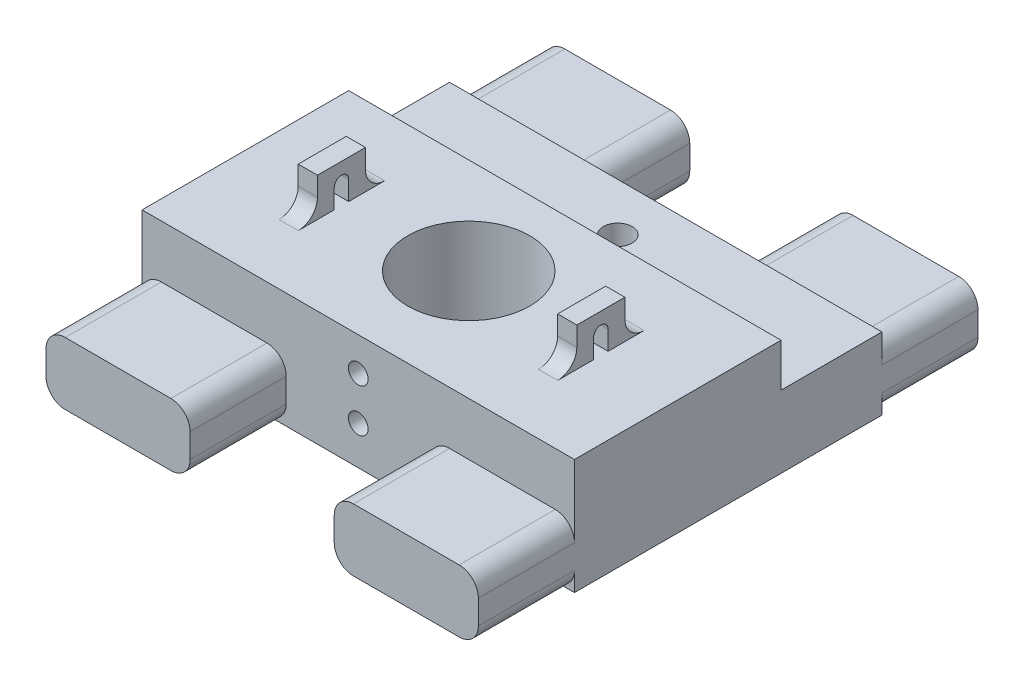
from build123d import *

# Parameters (mm, degrees)
SKETCH1_W                    = 45
SKETCH1_H                    = 32
BOSS_EXTRUDE1_DEPTH          = 12
SKETCH2_W                    = 45
SKETCH2_H                    = 10.5
CUT_EXTRUDE1_DEPTH           = 4.5
SKETCH3_R                    = 1.5
CUT_EXTRUDE2_DEPTH           = 7.5
SKETCH4_R                    = 6.35
CUT_EXTRUDE3_DEPTH           = 12
SKETCH5_W                    = 15
SKETCH5_H                    = 6.5
BOSS_EXTRUDE3_DEPTH          = 10
SKETCH6_W                    = 15
SKETCH6_H                    = 6.5
BOSS_EXTRUDE4_DEPTH          = 10
SKETCH7_W                    = 2
SKETCH7_H                    = 5
BOSS_EXTRUDE5_DEPTH          = 4
M2_5X0_45_TAPPED_HOLE1_D     = 2.05
M2_5X0_45_TAPPED_HOLE1_DEPTH = 11.499
M2_5X0_45_TAPPED_HOLE1_TIP   = 0.615882135
CUT_EXTRUDE4_REACH           = 65.6
CUT_EXTRUDE4_END_RADIUS      = 6.35
SKETCH10_R                   = 1.025
FILLET1_DEPTH                = 11
FILLET2_R                    = 2
FILLET3_DEPTH                = 11
FILLET4_R                    = 2
FILLET5_START                = -43
FILLET5_DEPTH                = 11
FILLET6_START                = -43
FILLET6_DEPTH                = 11
FILLET7_R                    = 2
CUT_EXTRUDE5_REACH           = 60.215
FILLET8_R                    = 2


with BuildPart() as part:
    # Sketch1 → Boss-Extrude1 (new body)
    with BuildSketch(Plane(origin=(0, 0, 0), x_dir=(1, 0, 0), z_dir=(0, 1, 0))):
        with Locations((22.5, 16)):
            Rectangle(SKETCH1_W, SKETCH1_H)
    extrude(amount=BOSS_EXTRUDE1_DEPTH)

    # Sketch2 → Cut-Extrude1 (cut)
    with BuildSketch(Plane(origin=(0, 12, 0), x_dir=(1, 0, 0), z_dir=(0, 1, 0))):
        with Locations((22.5, 26.75)):
            Rectangle(SKETCH2_W, SKETCH2_H)
    extrude(amount=-CUT_EXTRUDE1_DEPTH, mode=Mode.SUBTRACT)

    # Sketch3 → Cut-Extrude2 (cut)
    with BuildSketch(Plane(origin=(0, 7.5, 0), x_dir=(1, 0, 0), z_dir=(0, 1, 0))):
        with Locations(Location((22.5, 27, 0), (0, 0, 270))):
            Circle(SKETCH3_R)
    extrude(amount=-CUT_EXTRUDE2_DEPTH, mode=Mode.SUBTRACT)

    # Sketch4 → Cut-Extrude3 (cut)
    with BuildSketch(Plane(origin=(0, 12, 0), x_dir=(1, 0, 0), z_dir=(0, 1, 0))):
        with Locations(Location((22.5, 11.5, 0), (0, 0, 270))):
            Circle(SKETCH4_R)
    extrude(amount=-CUT_EXTRUDE3_DEPTH, mode=Mode.SUBTRACT)

    # Sketch5 → Boss-Extrude3 (add)
    with BuildSketch(Plane(origin=(0, 0, -32), x_dir=(-1, 0, 0), z_dir=(0, 0, -1))):
        with Locations((-37.5, 3.25)):
            Rectangle(SKETCH5_W, SKETCH5_H)
        with Locations((-7.5, 3.25)):
            Rectangle(SKETCH5_W, SKETCH5_H)
    extrude(amount=BOSS_EXTRUDE3_DEPTH)

    # Sketch6 → Boss-Extrude4 (add)
    with BuildSketch(Plane.XY):
        with Locations((7.5, 3.25)):
            Rectangle(SKETCH6_W, SKETCH6_H)
        with Locations((37.5, 3.25)):
            Rectangle(SKETCH6_W, SKETCH6_H)
    extrude(amount=BOSS_EXTRUDE4_DEPTH)

    # Sketch7 → Boss-Extrude5 (add)
    with BuildSketch(Plane(origin=(0, 12, 0), x_dir=(1, 0, 0), z_dir=(0, 1, 0))):
        with Locations((9, 10.75)):
            Rectangle(SKETCH7_W, SKETCH7_H)
        with Locations((36, 10.75)):
            Rectangle(SKETCH7_W, SKETCH7_H)
    extrude(amount=BOSS_EXTRUDE5_DEPTH)

    # M2.5x0.45 Tapped Hole1
    with Locations(Plane.XY):
        with Locations((22.5, 8.5)):
            Hole(M2_5X0_45_TAPPED_HOLE1_D / 2, depth=M2_5X0_45_TAPPED_HOLE1_DEPTH)
            with Locations((0, 0, -(M2_5X0_45_TAPPED_HOLE1_DEPTH + M2_5X0_45_TAPPED_HOLE1_TIP / 2))):  # 118° drill point
                Cone(0, M2_5X0_45_TAPPED_HOLE1_D / 2, M2_5X0_45_TAPPED_HOLE1_TIP, mode=Mode.SUBTRACT)

    # Cut-Extrude4: up to this cylinder (the profile starts outside it)
    cut_extrude4_end = Plane(origin=(22.5, 4, -11.5), z_dir=(0, 1, 0)) * Cylinder(CUT_EXTRUDE4_END_RADIUS, 144.9, mode=Mode.PRIVATE)
    # Sketch10 → Cut-Extrude4 (cut, up to the surface)
    with BuildSketch(Plane.XY, mode=Mode.PRIVATE) as cut_extrude4_sk1:
        with Locations((22.5, 4)):
            Circle(SKETCH10_R)
    cut_extrude4_tool1 = extrude(cut_extrude4_sk1.sketch, amount=-CUT_EXTRUDE4_REACH, mode=Mode.PRIVATE) - cut_extrude4_end
    add(cut_extrude4_tool1.solids().sort_by_distance((22.5, 4, 0))[0], mode=Mode.SUBTRACT)

    # Fillet1: read off the stored shape, not the designer's step
    # Fillet1 outline → Fillet1 (cut)
    with BuildSketch(Plane.XY):
        with BuildLine():
            Line((0, 0), (2, 0))
            ThreePointArc((2, 0), (0.585786438, 0.585786438), (0, 2))
            Line((0, 2), (0, 0))
        make_face()
    extrude(amount=FILLET1_DEPTH, mode=Mode.SUBTRACT)

    # Fillet2
    fillet2_edges = [part.edges().sort_by_distance(p)[0] for p in [
        (15, 0, 5),
        (30, 0, 5),
    ]]
    fillet(fillet2_edges, radius=FILLET2_R)

    # Fillet3: read off the stored shape, not the designer's step
    # Fillet3 outline → Fillet3 (cut)
    with BuildSketch(Plane.XY):
        with BuildLine():
            ThreePointArc((45, 2), (44.414213562, 0.585786438), (43, 0))
            Line((43, 0), (45, 0))
            Line((45, 0), (45, 2))
        make_face()
    extrude(amount=FILLET3_DEPTH, mode=Mode.SUBTRACT)

    # Fillet4
    fillet4_edges = [part.edges().sort_by_distance(p)[0] for p in [
        (30, 0, -37),
        (15, 0, -37),
    ]]
    fillet(fillet4_edges, radius=FILLET4_R)

    # Fillet5: read off the stored shape, not the designer's step
    # Fillet5 outline → Fillet5 (cut)
    with BuildSketch(Plane.XY.offset(FILLET5_START)):
        with BuildLine():
            ThreePointArc((45, 2), (44.414213562, 0.585786438), (43, 0))
            Line((43, 0), (45, 0))
            Line((45, 0), (45, 2))
        make_face()
    extrude(amount=FILLET5_DEPTH, mode=Mode.SUBTRACT)

    # Fillet6: read off the stored shape, not the designer's step
    # Fillet6 outline → Fillet6 (cut)
    with BuildSketch(Plane.XY.offset(FILLET6_START)):
        with BuildLine():
            Line((0, 0), (2, 0))
            ThreePointArc((2, 0), (0.585786438, 0.585786438), (0, 2))
            Line((0, 2), (0, 0))
        make_face()
    extrude(amount=FILLET6_DEPTH, mode=Mode.SUBTRACT)

    # Fillet7
    fillet7_edges = [part.edges().sort_by_distance(p)[0] for p in [
        (45, 6.5, -37),
        (30, 6.5, -37),
        (15, 6.5, -37),
        (0, 6.5, -37),
        (0, 6.5, 5),
        (15, 6.5, 5),
        (45, 6.5, 5),
        (30, 6.5, 5),
    ]]
    fillet(fillet7_edges, radius=FILLET7_R)

    # Cut-Extrude5: up to this face of the body (flat: up to its plane)
    cut_extrude5_end = Plane(part.part.faces().sort_by_distance((8, 14, -10.75))[0])
    # Sketch11 → Cut-Extrude5 (cut, up to the picked face)
    with BuildSketch(Plane(origin=(37, 0, 0), x_dir=(0, 0, -1), z_dir=(1, 0, 0)), mode=Mode.PRIVATE) as cut_extrude5_sk1:
        with BuildLine():
            Line((10, 14), (10, 12))
            Line((10, 12), (11.5, 12))
            Line((11.5, 12), (11.5, 14))
            ThreePointArc((11.5, 14), (10.75, 14.75), (10, 14))
        make_face()
    cut_extrude5_tool1 = split(extrude(cut_extrude5_sk1.sketch, amount=-CUT_EXTRUDE5_REACH, mode=Mode.PRIVATE), bisect_by=cut_extrude5_end, keep=Keep.BOTH, mode=Mode.PRIVATE)
    add(cut_extrude5_tool1.solids().sort_by(Axis((37, 13.299936, -10.75), (-1, 0, 0)))[0], mode=Mode.SUBTRACT)

    # Fillet8
    fillet8_edges = [part.edges().sort_by_distance(p)[0] for p in [
        (36, 12, -13.25),
        (9, 12, -8.25),
        (9, 12, -13.25),
        (36, 12, -8.25),
    ]]
    fillet(fillet8_edges, radius=FILLET8_R)


solid = part.part
